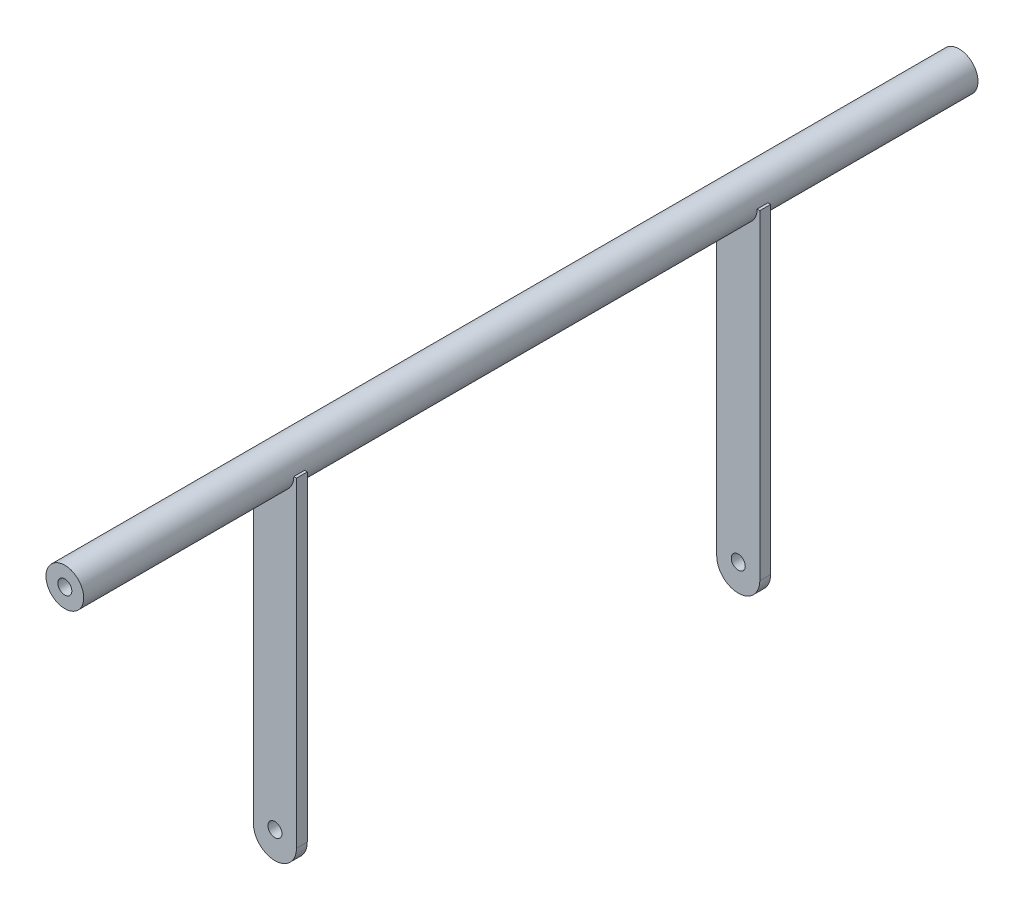
from build123d import *

# Parameters (mm, degrees)
SKETCH1_R           = 17.5
BOSS_EXTRUDE1_DEPTH = 415
CUT_EXTRUDE1_REACH  = 832.369
SKETCH2_R           = 6.5
SKETCH3_W           = 10
SKETCH3_H           = 317.5
BOSS_EXTRUDE2_DEPTH = 20
FILLET1_R           = 20
SKETCH4_R           = 6.5
CUT_EXTRUDE2_DEPTH  = 542


with BuildPart() as part:
    # Sketch1 → Boss-Extrude1 (new, symmetric)
    with BuildSketch(Plane.XY):
        Circle(SKETCH1_R)
    extrude(amount=BOSS_EXTRUDE1_DEPTH, both=True)

    # Sketch2 → Cut-Extrude1 (cut, up to next)
    with BuildSketch(Plane.XY.offset(415), mode=Mode.PRIVATE) as cut_extrude1_sk1:
        Circle(SKETCH2_R)
    cut_extrude1_tool1 = extrude(cut_extrude1_sk1.sketch, amount=-CUT_EXTRUDE1_REACH, mode=Mode.PRIVATE) & part.part
    add(cut_extrude1_tool1.solids().sort_by_distance((0, 0, 415))[0], mode=Mode.SUBTRACT)

    # Sketch3 → Boss-Extrude2 (add, symmetric)
    with BuildSketch(Plane(origin=(0, 0, 0), x_dir=(0, 0, -1), z_dir=(1, 0, 0))):
        with Locations((-215, -158.75)):
            Rectangle(SKETCH3_W, SKETCH3_H)
        with Locations((215, -158.75)):
            Rectangle(SKETCH3_W, SKETCH3_H)
    extrude(amount=BOSS_EXTRUDE2_DEPTH, both=True)

    # Fillet1
    fillet1_edges = [part.edges().sort_by_distance(p)[0] for p in [
        (-20, -317.5, -215),
        (20, -317.5, -215),
        (-20, -317.5, 215),
        (20, -317.5, 215),
    ]]
    fillet(fillet1_edges, radius=FILLET1_R - 0.0001)  # a hair under: the kernel refuses the full size

    # Sketch4 → Cut-Extrude2 (cut)
    with BuildSketch(Plane.XY.offset(220)):
        with Locations(Location((0, -292.5, 0), (0, 0, 270))):
            Circle(SKETCH4_R)
    extrude(amount=-CUT_EXTRUDE2_DEPTH, mode=Mode.SUBTRACT)


solid = part.part
